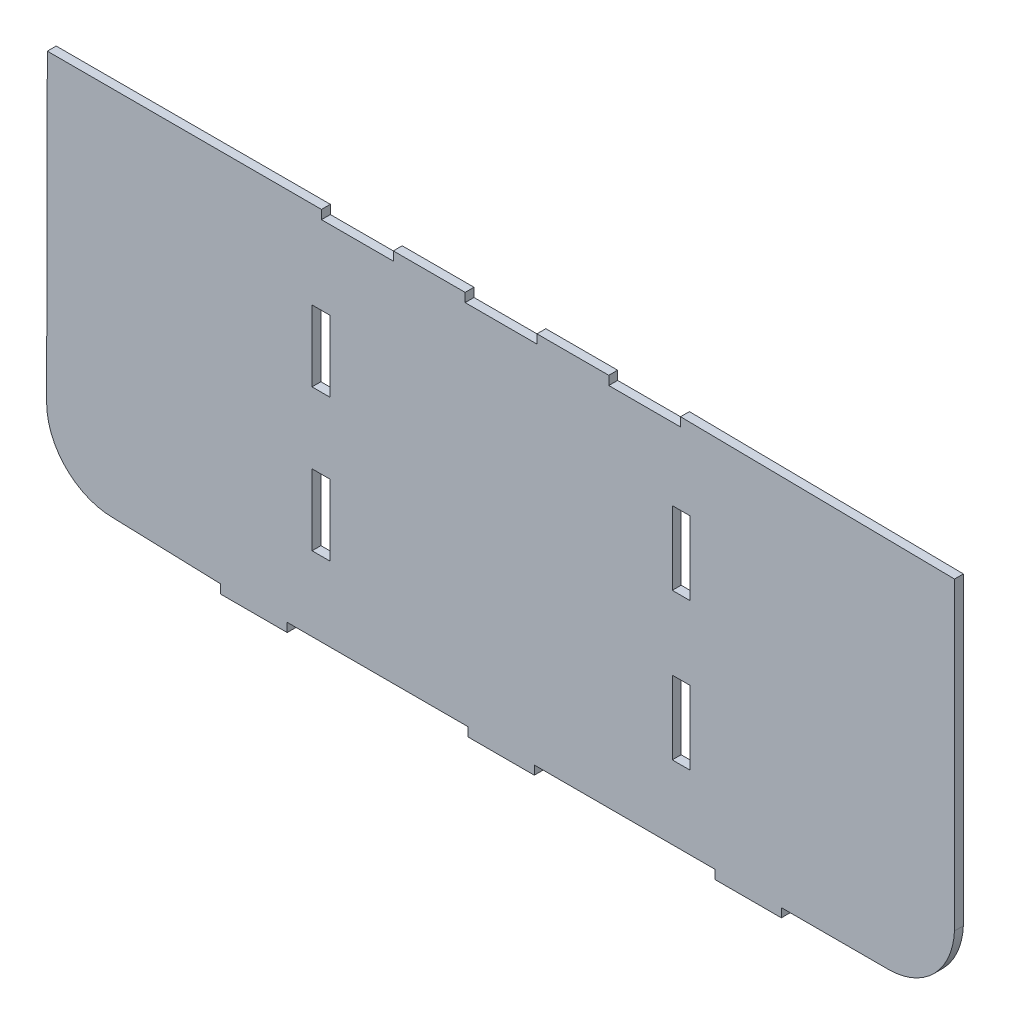
from build123d import *

# Parameters (mm, degrees)
SKETCH1_W           = 20.32
SKETCH1_H           = 81.316938585
SKETCH1_H_2         = 84.113540858
BOSS_EXTRUDE1_DEPTH = 10.16


with BuildPart() as part:
    # Sketch1 → Boss-Extrude1 (new body)
    with BuildSketch(Plane.XY):
        with BuildLine():
            ThreePointArc((-520.699999986, 86.36), (-498.381536717, 32.478463279), (-444.5, 10.16))
            Line((-444.5, 10.16), (-321.2, 6.224098454))
            Line((-321.2, 6.224098454), (-321.2, -3.935901546))
            Line((-321.2, -3.935901546), (-245, -3.935901546))
            Line((-245, -3.935901546), (-245, 6.224098454))
            Line((-245, 6.224098454), (-38.1, 6.224098454))
            Line((-38.1, 6.224098454), (-38.1, -3.935901546))
            Line((-38.1, -3.935901546), (38.1, -3.935901546))
            Line((38.1, -3.935901546), (38.1, 6.224098454))
            Line((38.1, 6.224098454), (245, 6.224098454))
            Line((245, 6.224098454), (245, -3.935901546))
            Line((245, -3.935901546), (321.2, -3.935901546))
            Line((321.2, -3.935901546), (321.2, 6.224098454))
            Line((321.2, 6.224098454), (444.500003861, 6.224098454))
            add(Edge.make_bspline(
                [(444.500003861, 6.224098454), (515.95239936, 6.874421698), (519.602099184, 82.264098454)],
                knots=[3.150207658, 3.150207658, 3.150207658, 4.66128988, 4.66128988, 4.66128988], degree=2, weights=[1, 0.727900619, 1]))
            Line((519.602099184, 82.264098454), (519.625894946, 431.514078957))
            Line((519.625894946, 431.514078957), (205.706405146, 435.61))
            Line((205.706405146, 435.61), (205.558012439, 425.45))
            Line((205.558012439, 425.45), (123.444, 425.45))
            Line((123.444, 425.45), (123.444, 435.61))
            Line((123.444, 435.61), (41.148, 435.61))
            Line((41.148, 435.61), (41.148, 425.45))
            Line((41.148, 425.45), (-41.148, 425.45))
            Line((-41.148, 425.45), (-41.148, 435.61))
            Line((-41.148, 435.61), (-123.444, 435.61))
            Line((-123.444, 435.61), (-123.444, 425.45))
            Line((-123.444, 425.45), (-205.739999986, 425.45))
            Line((-205.739999986, 425.45), (-205.739999986, 435.61))
            Line((-205.739999986, 435.61), (-519.915689474, 435.61))
            Line((-519.915689474, 435.61), (-520.699999986, 86.36))
        make_face()
        with Locations((-206.375268781, 132.135407878)):
            Rectangle(SKETCH1_W, SKETCH1_H, mode=Mode.SUBTRACT)
        with Locations((206.375268781, 132.394409741)):
            Rectangle(SKETCH1_W, SKETCH1_H_2, mode=Mode.SUBTRACT)
        with Locations((-206.375268781, 294.769285048)):
            Rectangle(SKETCH1_W, SKETCH1_H, mode=Mode.SUBTRACT)
        with Locations((206.375268781, 300.621491457)):
            Rectangle(SKETCH1_W, SKETCH1_H_2, mode=Mode.SUBTRACT)
    extrude(amount=BOSS_EXTRUDE1_DEPTH)


solid = part.part
